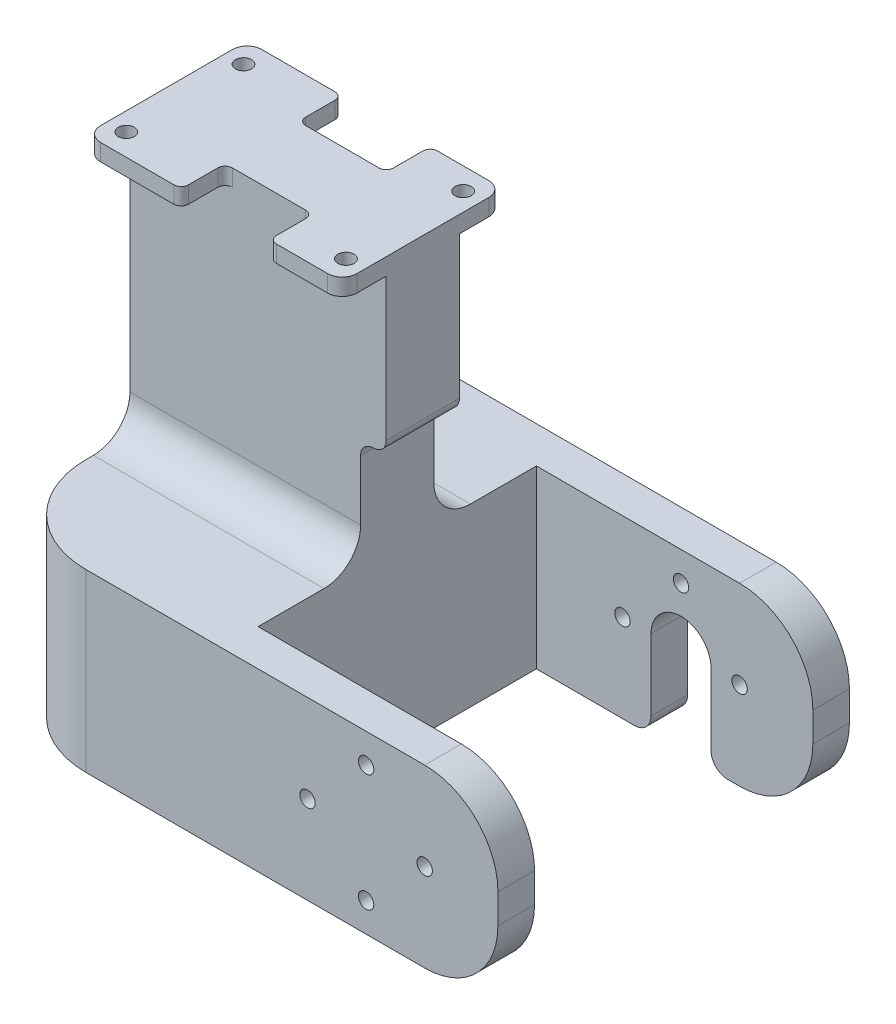
from build123d import *

# Parameters (mm, degrees)
EXTRUDE_1_DEPTH         = 24
SKETCH_2_W              = 24
SKETCH_2_H              = 29.5
CUT_EXTRUDE_1_DEPTH     = 79.714674617
SKETCH_3_R              = 1.1
CUT_EXTRUDE_2_DEPTH     = 96.205041883
SKETCH_4_W              = 15
SKETCH_4_H              = 48
EXTRUDE_2_DEPTH         = 52
SKETCH_5_W              = 35
SKETCH_5_H              = 13
CUT_EXTRUDE_3_DEPTH     = 52
SKETCH_6_W              = 35
SKETCH_6_H              = 20.5
CUT_EXTRUDE_4_DEPTH     = 11.5
SKETCH_7_W              = 35
SKETCH_7_H              = 19
CUT_EXTRUDE_5_DEPTH     = 37.5
SKETCH_8_R              = 1.1
CUT_EXTRUDE_6_DEPTH     = 3
CUT_EXTRUDE_7_DEPTH     = 96.205041883
SKETCH_10_W             = 35
SKETCH_10_H             = 22
CUT_EXTRUDE_8_DEPTH     = 11.5
SKETCH_11_W             = 12
SKETCH_11_H             = 6
CUT_EXTRUDE_9_DEPTH     = 3
FILLET_1_R              = 2
FILLET_2_R              = 1
SKETCH_14_R             = 0.75
CUT_EXTRUDE_12_DEPTH    = 8
SKETCH_17_R             = 1.9
CUT_EXTRUDE_13_DEPTH    = 1.4
SKETCH_26_W             = 65.219467354
SKETCH_26_H             = 31.879169378
CUT_EXTRUDE_17_DEPTH    = 2.75
CUT_EXTRUDE_18_DEPTH    = 0.7
SKETCH_28_R             = 4.45
EXTRUDE_11_DEPTH        = 8
EXTRUDE_12_REACH        = 89.179
SKETCH_29_W             = 35
SKETCH_29_H             = 48
SKETCH4_R               = 1.9
CUT_EXTRUDE3_DEPTH      = 1
BOSS_EXTRUDE2_DEPTH     = 9.25
CUT_EXTRUDE4_START      = -17.25
CUT_EXTRUDE4_DEPTH      = 8
BOSS_EXTRUDE3_START     = 29.5
BOSS_EXTRUDE3_DEPTH     = 9.25
CUT_EXTRUDE5_START      = 38.75
CUT_EXTRUDE5_DEPTH      = 49.724639182
SKETCH6_W               = 10
SKETCH6_H               = 20
BOSS_EXTRUDE4_DEPTH     = 9.25
BOSS_EXTRUDE5_START     = -38.75
SKETCH6_2_W             = 10
SKETCH6_2_H             = 20
BOSS_EXTRUDE5_DEPTH     = 9.25
MOVE_FACE1_BY           = 2
MOVE_FACE2_BY           = 2
MOVE_FACE3_BY           = 8
MOVE_FACE3_2_BY         = 8
CUT_EXTRUDE6_DEPTH      = 15
CUT_EXTRUDE6_DEPTH_BACK = 77.826102335
SKETCH7_W               = 37.75
SKETCH7_H               = 38
SKETCH8_R               = 1.05
CUT_EXTRUDE7_DEPTH      = 94.264409074
CUT_EXTRUDE8_REACH      = 95.264
FILLET1_R               = 10
FILLET2_R               = 2.25
FILLET3_R               = 1.75
FILLET4_R               = 13
FILLET5_R               = 5


with BuildPart() as part:
    # 草图1 → 凸台-拉伸1 (new, symmetric)
    with BuildSketch(Plane.XY):
        with BuildLine():
            Line((10, 10), (44, 10))
            ThreePointArc((44, 10), (54, 0), (44, -10))
            Line((44, -10), (0, -10))
            Line((0, -10), (-10, -10))
            Line((-10, -10), (-10, 0))
            Line((-10, 0), (-10, 62))
            Line((-10, 62), (10, 62))
            Line((10, 62), (10, 10))
        make_face()
    extrude(amount=EXTRUDE_1_DEPTH, both=True)

    # 草图2 → 切除-拉伸1 (cut, through all)
    with BuildSketch(Plane(origin=(0, 10, 0), x_dir=(1, 0, 0), z_dir=(0, 1, 0))):
        with Locations((42, 0)):
            Rectangle(SKETCH_2_W, SKETCH_2_H)
    extrude(amount=-CUT_EXTRUDE_1_DEPTH, mode=Mode.SUBTRACT)

    # 草图3 → 切除-拉伸2 (cut, through all)
    with BuildSketch(Plane.XY.offset(24)):
        with Locations((44, 6)):
            Circle(SKETCH_3_R)
        with Locations((50, 0)):
            Circle(SKETCH_3_R)
        with Locations((44, -6)):
            Circle(SKETCH_3_R)
        with Locations((38, 0)):
            Circle(SKETCH_3_R)
    extrude(amount=-CUT_EXTRUDE_2_DEPTH, mode=Mode.SUBTRACT)

    # 草图4 → 凸台-拉伸2 (add, through all)
    with BuildSketch(Plane(origin=(0, 10, 0), x_dir=(1, 0, 0), z_dir=(0, 1, 0))):
        with Locations((17.5, 0)):
            Rectangle(SKETCH_4_W, SKETCH_4_H)
    extrude(amount=EXTRUDE_2_DEPTH)

    # 草图5 → 切除-拉伸3 (cut)
    with BuildSketch(Plane(origin=(0, 62, 0), x_dir=(1, 0, 0), z_dir=(0, 1, 0))):
        with Locations((7.5, -17.5)):
            Rectangle(SKETCH_5_W, SKETCH_5_H)
        with Locations((7.5, 17.5)):
            Rectangle(SKETCH_5_W, SKETCH_5_H)
    extrude(amount=-CUT_EXTRUDE_3_DEPTH, mode=Mode.SUBTRACT)

    # 草图6 → 切除-拉伸4 (cut)
    with BuildSketch(Plane(origin=(0, 62, 0), x_dir=(1, 0, 0), z_dir=(0, 1, 0))):
        with Locations((7.5, 0)):
            Rectangle(SKETCH_6_W, SKETCH_6_H)
    extrude(amount=-CUT_EXTRUDE_4_DEPTH, mode=Mode.SUBTRACT)

    # 草图7 → 切除-拉伸5 (cut)
    with BuildSketch(Plane(origin=(0, 10, 0), x_dir=(1, 0, 0), z_dir=(0, 1, 0))):
        with Locations((7.5, 14.5)):
            Rectangle(SKETCH_7_W, SKETCH_7_H)
        with Locations((7.5, -14.5)):
            Rectangle(SKETCH_7_W, SKETCH_7_H)
    extrude(amount=CUT_EXTRUDE_5_DEPTH, mode=Mode.SUBTRACT)

    # 草图8 → 切除-拉伸6 (cut)
    with BuildSketch(Plane(origin=(0, 50.5, 0), x_dir=(1, 0, 0), z_dir=(0, 1, 0))):
        with Locations(Location((-7.5, 8, 0), (0, 0, 270))):
            Circle(SKETCH_8_R)
        with Locations(Location((22.5, 8, 0), (0, 0, 270))):
            Circle(SKETCH_8_R)
        with Locations(Location((22.5, -8, 0), (0, 0, 270))):
            Circle(SKETCH_8_R)
        with Locations(Location((-7.5, -8, 0), (0, 0, 270))):
            Circle(SKETCH_8_R)
    extrude(amount=-CUT_EXTRUDE_6_DEPTH, mode=Mode.SUBTRACT)

    # 草图9 → 切除-拉伸7 (cut, through all)
    with BuildSketch(Plane.XY.offset(24)):
        Polygon((-10, 4), (25, -10), (-10, -10), align=None)
    extrude(amount=-CUT_EXTRUDE_7_DEPTH, mode=Mode.SUBTRACT)

    # 草图10 → 切除-拉伸8 (cut)
    with BuildSketch(Plane(origin=(0, 62, 0), x_dir=(1, 0, 0), z_dir=(0, 1, 0))):
        with Locations((7.5, 0)):
            Rectangle(SKETCH_10_W, SKETCH_10_H)
    extrude(amount=-CUT_EXTRUDE_8_DEPTH, mode=Mode.SUBTRACT)

    # 草图11 → 切除-拉伸9 (cut)
    with BuildSketch(Plane(origin=(0, 50.5, 0), x_dir=(1, 0, 0), z_dir=(0, 1, 0))):
        with Locations((9, -8)):
            Rectangle(SKETCH_11_W, SKETCH_11_H)
        with Locations((9, 8)):
            Rectangle(SKETCH_11_W, SKETCH_11_H)
    extrude(amount=-CUT_EXTRUDE_9_DEPTH, mode=Mode.SUBTRACT)

    # 圆角1
    fillet_1_edges = [part.edges().sort_by_distance(p)[0] for p in [
        (-10, 49, -11),
        (25, 49, -11),
        (25, 49, 11),
        (-10, 49, 11),
    ]]
    fillet(fillet_1_edges, radius=FILLET_1_R)

    # 圆角2
    fillet_2_edges = [part.edges().sort_by_distance(p)[0] for p in [
        (3, 49, 11),
        (3, 49, 5),
        (15, 49, 5),
        (15, 49, 11),
        (3, 49, -11),
        (15, 49, -11),
        (15, 49, -5),
        (3, 49, -5),
    ]]
    fillet(fillet_2_edges, radius=FILLET_2_R)

    # 草图14 → 切除-拉伸12 (cut)
    with BuildSketch(Plane.XY.offset(24)):
        with Locations((12, 7)):
            Circle(SKETCH_14_R)
        with Locations((26, 7)):
            Circle(SKETCH_14_R)
    extrude(amount=-CUT_EXTRUDE_12_DEPTH, mode=Mode.SUBTRACT)

    # 草图17 → 切除-拉伸13 (cut)
    with BuildSketch(Plane.XY.offset(24)):
        with Locations((44, 6)):
            Circle(SKETCH_17_R)
        with Locations((50, 0)):
            Circle(SKETCH_17_R)
        with Locations((44, -6)):
            Circle(SKETCH_17_R)
        with Locations((38, 0)):
            Circle(SKETCH_17_R)
    extrude(amount=-CUT_EXTRUDE_13_DEPTH, mode=Mode.SUBTRACT)

    # 草图26 → 切除-拉伸17 (cut)
    with BuildSketch(Plane(origin=(30, 0, 0), x_dir=(0, 0, -1), z_dir=(1, 0, 0))):
        with Locations((0, -0.918796831)):
            Rectangle(SKETCH_26_W, SKETCH_26_H)
    extrude(amount=-CUT_EXTRUDE_17_DEPTH, mode=Mode.SUBTRACT)


with BuildPart() as cut_extrude_17_piece_1:
    # of the separate pieces the step leaves, piece 1, a body of its own (cut_extrude_17_pieces)
    add(part.part.solids().sort_by_distance((2, 47.5, -11))[0])


with BuildPart() as cut_extrude_17_piece_2:
    # of the separate pieces the step leaves, piece 2, a body of its own (cut_extrude_17_pieces)
    add(part.part.solids().sort_by_distance((44, 10, -24))[0])


with BuildPart() as cut_extrude_17_piece_3:
    # of the separate pieces the step leaves, piece 3, a body of its own (cut_extrude_17_pieces)
    add(part.part.solids().sort_by_distance((30, 10, 24))[0])


with BuildPart() as cut_extrude_17_piece_1_1:
    # Move Body 1: moved
    add(cut_extrude_17_piece_1.part.moved(Location((2.75, 0, 0))))


with BuildPart() as cut_extrude_17_piece_2_1:
    add(cut_extrude_17_piece_2.part)

    # Combine 1: union 切除-拉伸17 piece 3, 切除-拉伸17 piece 1
    add(cut_extrude_17_piece_3.part)
    add(cut_extrude_17_piece_1_1.part)

    # 草图27 → 切除-拉伸18 (cut)
    with BuildSketch(Plane.XZ.offset(-47.5)):
        with BuildLine():
            Line((25.75, 11), (18.75, 11))
            ThreePointArc((18.75, 11), (18.042893219, 10.707106781), (17.75, 10))
            Line((17.75, 10), (17.75, 6))
            ThreePointArc((17.75, 6), (17.457106781, 5.292893219), (16.75, 5))
            Line((16.75, 5), (27.75, 5))
            Line((27.75, 5), (27.75, 9))
            ThreePointArc((27.75, 9), (27.164213562, 10.414213562), (25.75, 11))
        make_face()
        with BuildLine():
            Line((5.75, 6), (5.75, 10))
            ThreePointArc((5.75, 10), (5.457106781, 10.707106781), (4.75, 11))
            Line((4.75, 11), (-5.25, 11))
            ThreePointArc((-5.25, 11), (-6.664213562, 10.414213562), (-7.25, 9))
            Line((-7.25, 9), (-7.25, 5))
            Line((-7.25, 5), (6.75, 5))
            ThreePointArc((6.75, 5), (6.042893219, 5.292893219), (5.75, 6))
        make_face()
        with BuildLine():
            Line((-5.25, -11), (4.75, -11))
            ThreePointArc((4.75, -11), (5.457106781, -10.707106781), (5.75, -10))
            Line((5.75, -10), (5.75, -6))
            ThreePointArc((5.75, -6), (6.042893219, -5.292893219), (6.75, -5))
            Line((6.75, -5), (-7.25, -5))
            Line((-7.25, -5), (-7.25, -9))
            ThreePointArc((-7.25, -9), (-6.664213562, -10.414213562), (-5.25, -11))
        make_face()
        with BuildLine():
            Line((17.75, -6), (17.75, -10))
            ThreePointArc((17.75, -10), (18.042893219, -10.707106781), (18.75, -11))
            Line((18.75, -11), (25.75, -11))
            ThreePointArc((25.75, -11), (27.164213562, -10.414213562), (27.75, -9))
            Line((27.75, -9), (27.75, -5))
            Line((27.75, -5), (16.75, -5))
            ThreePointArc((16.75, -5), (17.457106781, -5.292893219), (17.75, -6))
        make_face()
    extrude(amount=-CUT_EXTRUDE_18_DEPTH, mode=Mode.SUBTRACT)

    # 草图28 → 凸台-拉伸11 (add)
    with BuildSketch(Plane.XY.offset(24)):
        with Locations(Location((44, 0, 0), (0, 0, 167.792342))):
            Circle(SKETCH_28_R)
    extrude(amount=EXTRUDE_11_DEPTH)

    # 凸台-拉伸12: up to this face of the body (flat: up to its plane)
    extrude_12_end = Plane(cut_extrude_17_piece_2_1.part.faces().sort_by_distance((10.25, -3, 0))[0])
    # 草图29 → 凸台-拉伸12 (add, up to the picked face)
    with BuildSketch(Plane.XZ.offset(10), mode=Mode.PRIVATE) as extrude_12_sk1:
        with Locations((10.25, 0)):
            Rectangle(SKETCH_29_W, SKETCH_29_H)
    extrude_12_tool1 = split(extrude(extrude_12_sk1.sketch, amount=-EXTRUDE_12_REACH, mode=Mode.PRIVATE), bisect_by=extrude_12_end, keep=Keep.BOTH, mode=Mode.PRIVATE)
    add(extrude_12_tool1.solids().sort_by(Axis((10.25, -10, 0), (0, 1, 0)))[0])

    # Mirror12: 切除-拉伸17 piece 2 across plane


with BuildPart() as cut_extrude_17_piece_2_2:
    add(cut_extrude_17_piece_2_1.part)
    add(cut_extrude_17_piece_2_1.part.mirror(Plane.XY))

    # Sketch4 → Cut-Extrude3 (cut)
    with BuildSketch(Plane.XY.offset(24)):
        with Locations((38, 0)):
            Circle(SKETCH4_R)
        with Locations((44, -6)):
            Circle(SKETCH4_R)
        with Locations((50, 0)):
            Circle(SKETCH4_R)
        with Locations((44, 6)):
            Circle(SKETCH4_R)
    cut_extrude3 = extrude(amount=-CUT_EXTRUDE3_DEPTH, mode=Mode.SUBTRACT)

    # Mirror13: Cut-Extrude3 across plane
    add(cut_extrude3.mirror(Plane.XY), mode=Mode.SUBTRACT)

    # Sketch5 → Boss-Extrude2 (add)
    with BuildSketch(Plane(origin=(0, 0, 14.75), x_dir=(-1, 0, 0), z_dir=(0, 0, -1))):
        with BuildLine():
            Line((-44, -10), (-30, -10))
            Line((-30, -10), (-30, 10))
            Line((-30, 10), (-44, 10))
            ThreePointArc((-44, 10), (-54, 0), (-44, -10))
        make_face()
    extrude(amount=-BOSS_EXTRUDE2_DEPTH)

    # Sketch5<2> → Cut-Extrude4 (cut)
    with BuildSketch(Plane(origin=(0, 0, 14.75), x_dir=(-1, 0, 0), z_dir=(0, 0, -1)).offset(CUT_EXTRUDE4_START)):
        with BuildLine():
            Line((-44, -10), (-30, -10))
            Line((-30, -10), (-30, 10))
            Line((-30, 10), (-44, 10))
            ThreePointArc((-44, 10), (-54, 0), (-44, -10))
        make_face()
    extrude(amount=CUT_EXTRUDE4_DEPTH, mode=Mode.SUBTRACT)

    # Sketch5<3> → Boss-Extrude3 (add)
    with BuildSketch(Plane(origin=(0, 0, 14.75), x_dir=(-1, 0, 0), z_dir=(0, 0, -1)).offset(BOSS_EXTRUDE3_START)):
        with BuildLine():
            Line((-44, -10), (-30, -10))
            Line((-30, -10), (-30, 10))
            Line((-30, 10), (-44, 10))
            ThreePointArc((-44, 10), (-54, 0), (-44, -10))
        make_face()
    extrude(amount=BOSS_EXTRUDE3_DEPTH)

    # Sketch5<4> → Cut-Extrude5 (cut, through all)
    with BuildSketch(Plane(origin=(0, 0, 14.75), x_dir=(-1, 0, 0), z_dir=(0, 0, -1)).offset(CUT_EXTRUDE5_START)):
        with BuildLine():
            Line((-44, -10), (-30, -10))
            Line((-30, -10), (-30, 10))
            Line((-30, 10), (-44, 10))
            ThreePointArc((-44, 10), (-54, 0), (-44, -10))
        make_face()
    extrude(amount=CUT_EXTRUDE5_DEPTH, mode=Mode.SUBTRACT)

    # Sketch6 → Boss-Extrude4 (add)
    with BuildSketch(Plane.XY.offset(24)):
        with Locations((49, 0)):
            Rectangle(SKETCH6_W, SKETCH6_H)
    extrude(amount=-BOSS_EXTRUDE4_DEPTH)

    # Sketch6<2> → Boss-Extrude5 (add)
    with BuildSketch(Plane.XY.offset(24).offset(BOSS_EXTRUDE5_START)):
        with Locations((49, 0)):
            Rectangle(SKETCH6_2_W, SKETCH6_2_H)
    extrude(amount=-BOSS_EXTRUDE5_DEPTH)

    # Move Face1: a face moved outward by 2.0
    extrude(cut_extrude_17_piece_2_2.faces().sort_by_distance((23.375, 10, -12))[0], amount=MOVE_FACE1_BY, dir=(0, 1, 0))

    # Move Face2: a face moved outward by 2.0
    extrude(cut_extrude_17_piece_2_2.faces().sort_by_distance((17.467069892, -10, 0))[0], amount=MOVE_FACE2_BY, dir=(0, -1, 0))

    # Move Face3: a face moved outward by 8.0
    extrude(cut_extrude_17_piece_2_2.faces().sort_by_distance((54, 0, 19.375))[0], amount=MOVE_FACE3_BY, dir=(1, 0, 0))

    # Move Face3 2: a face moved outward by 8.0
    extrude(cut_extrude_17_piece_2_2.faces().sort_by_distance((54, 0, -19.375))[0], amount=MOVE_FACE3_2_BY, dir=(1, 0, 0))

    # Sketch7 → Cut-Extrude6 (cut, two sides: drawn at the far end of the back side and taken through both)
    with BuildSketch(Plane(origin=(0, 12, 0), x_dir=(1, 0, 0), z_dir=(0, 1, 0)).offset(-CUT_EXTRUDE6_DEPTH_BACK)):
        with Locations((43.125, 0)):
            Rectangle(SKETCH7_W, SKETCH7_H)
    extrude(amount=CUT_EXTRUDE6_DEPTH + CUT_EXTRUDE6_DEPTH_BACK, mode=Mode.SUBTRACT)

    # Sketch8 → Cut-Extrude7 (cut, through all)
    with BuildSketch(Plane(origin=(0, 0, -24), x_dir=(-1, 0, 0), z_dir=(0, 0, -1))):
        with Locations((-44, 8)):
            Circle(SKETCH8_R)
        with Locations((-36, 0)):
            Circle(SKETCH8_R)
        with Locations((-44, -8)):
            Circle(SKETCH8_R)
        with Locations((-52, 0)):
            Circle(SKETCH8_R)
    extrude(amount=-CUT_EXTRUDE7_DEPTH, mode=Mode.SUBTRACT)

    # Sketch9 → Cut-Extrude8 (cut, up to next)
    with BuildSketch(Plane(origin=(0, 0, -24), x_dir=(-1, 0, 0), z_dir=(0, 0, -1)), mode=Mode.PRIVATE) as cut_extrude8_sk1:
        with BuildLine():
            Line((-48.1, 0), (-48.1, -12))
            Line((-48.1, -12), (-39.9, -12))
            Line((-39.9, -12), (-39.9, 0))
            ThreePointArc((-39.9, 0), (-44, 4.1), (-48.1, 0))
        make_face()
    cut_extrude8_tool1 = extrude(cut_extrude8_sk1.sketch, amount=-CUT_EXTRUDE8_REACH, mode=Mode.PRIVATE) & cut_extrude_17_piece_2_2.part
    add(cut_extrude8_tool1.solids().sort_by_distance((44, -4.362424, -24))[0], mode=Mode.SUBTRACT)

    # Fillet1
    fillet1_edges = [cut_extrude_17_piece_2_2.edges().sort_by_distance(p)[0] for p in [
        (62, 12, -21.5),
        (62, -12, -21.5),
        (62, -12, 21.5),
        (62, 12, 21.5),
    ]]
    fillet(fillet1_edges, radius=FILLET1_R)

    # Fillet2
    fillet2_edges = [cut_extrude_17_piece_2_2.edges().sort_by_distance(p)[0] for p in [
        (48.1, -12, -21.5),
        (39.9, -12, -21.5),
    ]]
    fillet(fillet2_edges, radius=FILLET2_R)

    # Fillet3
    fillet3_edges = [cut_extrude_17_piece_2_2.edges().sort_by_distance(p)[0] for p in [
        (24.25, 27, 0),
    ]]
    fillet(fillet3_edges, radius=FILLET3_R)
    fillet3_2_edges = [cut_extrude_17_piece_2_2.edges().sort_by_distance(p)[0] for p in [
        (27.75, 27, 0),
    ]]
    fillet(fillet3_2_edges, radius=FILLET3_R - 0.0001)  # a hair under: the kernel refuses the full size

    # Fillet4
    fillet4_edges = [cut_extrude_17_piece_2_2.edges().sort_by_distance(p)[0] for p in [
        (-7.25, 0, 24),
        (-7.25, 0, -24),
    ]]
    fillet(fillet4_edges, radius=FILLET4_R)

    # Fillet5
    fillet5_edges = [cut_extrude_17_piece_2_2.edges().sort_by_distance(p)[0] for p in [
        (8.5, 12, 5),
        (8.5, 12, -5),
    ]]
    fillet(fillet5_edges, radius=FILLET5_R)


solid = cut_extrude_17_piece_2_2.part
